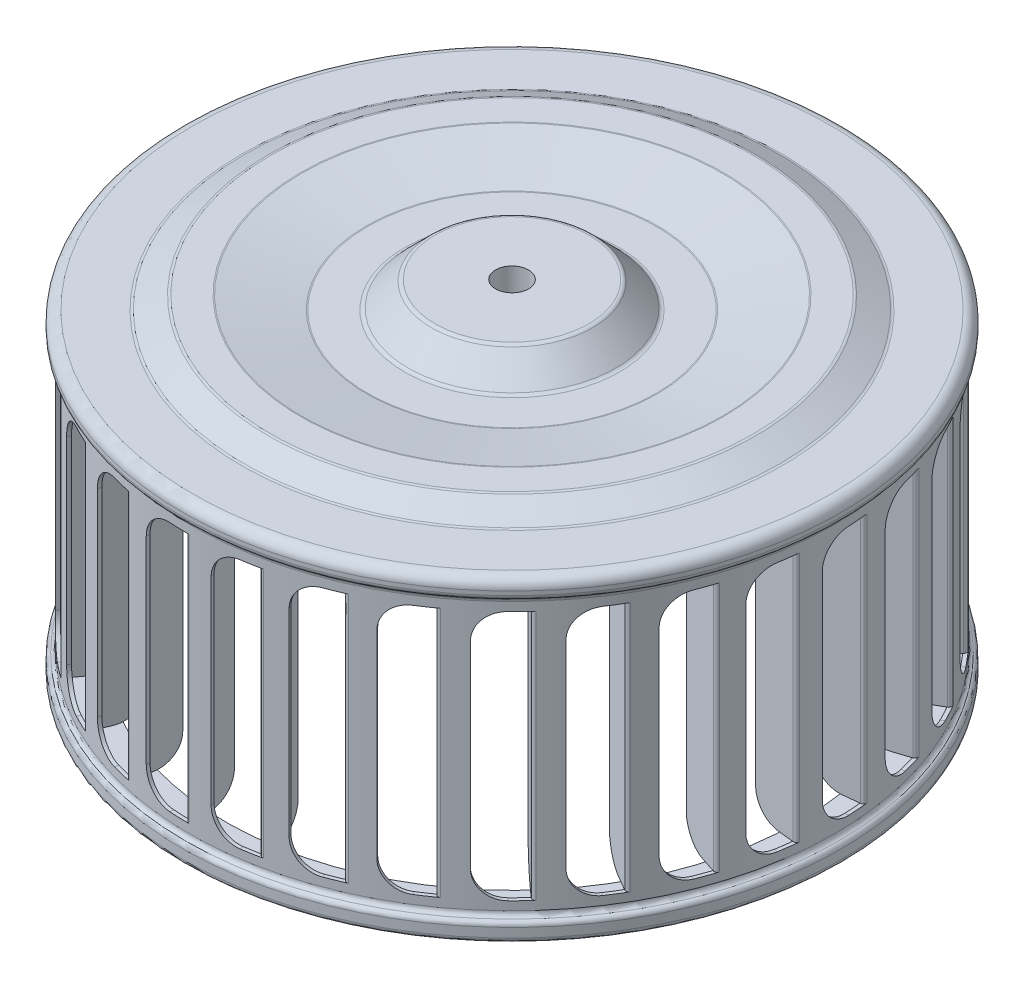
from build123d import *

# Parameters (mm, degrees)
FILLET1_R                = 1.27
CUT_EXTRUDE2_DEPTH       = 88.89999999999999
BOSS_EXTRUDE3_DEPTH      = 0.762
FILLET3_R                = 0.762
FILLET4_R                = 0.254
CIRPATTERN1_COUNT        = 30
FILLET3_OF_CIRPATTERN1_R = 0.762
FILLET4_OF_CIRPATTERN1_R = 0.254
SKETCH2_R                = 15.08125
BOSS_EXTRUDE1_DEPTH      = 19.05
FILLET2_R                = 0.508
SKETCH3_R                = 3.96875
CUT_EXTRUDE1_DEPTH       = 19.939
SKETCH8_R                = 78.74000000000001
SKETCH8_R_2              = 69.05625
BOSS_EXTRUDE4_DEPTH      = 0.762
FILLET5_R                = 2.54
FILLET6_R                = 0.762


# Read off the part's stored shape, not the designer's step: Shell1
with BuildPart() as part:
    # Sketch1 → Revolve1 (revolve)
    with BuildSketch(Plane.XY, mode=Mode.PRIVATE) as revolve1_sk:
        with BuildLine():
            Line((0, 0), (1.011e-14, -82.55))
            Line((1.011e-14, -82.55), (78.105, -82.54999999999998))
            ThreePointArc((78.105, -82.54999999999998), (79.00302561210692, -82.1780256121069), (79.37500000000001, -81.27999999999997))
            Line((79.37500000000001, -81.27999999999997), (79.37500000000001, -79.05749999999999))
            ThreePointArc((79.37500000000001, -79.05749999999999), (79.00302561210692, -78.15947438789307), (78.105, -77.78749999999998))
            Line((78.105, -77.78749999999998), (77.78750000000001, -77.78749999999998))
            Line((77.78750000000001, -77.78749999999998), (77.7875, -11.1125))
            Line((77.7875, -11.1125), (78.10499999999999, -11.1125))
            ThreePointArc((78.10499999999999, -11.1125), (79.00302561210691, -10.740525612106918), (79.375, -9.842499999999992))
            Line((79.375, -9.842499999999992), (79.375, -8.890000000000018))
            ThreePointArc((79.375, -8.890000000000018), (78.63105122421382, -7.093948775786171), (76.83499999999998, -6.35))
            Line((76.83499999999998, -6.35), (65.06980633142473, -6.349999999999999))
            ThreePointArc((65.06980633142473, -6.349999999999999), (64.77802012232958, -6.316026216624016), (64.50184506513978, -6.2159225325698895))
            Line((64.50184506513978, -6.2159225325698895), (58.688154934860215, -3.309077467430109))
            ThreePointArc((58.688154934860215, -3.309077467430109), (58.41197987767042, -3.2089737833759826), (58.12019366857527, -3.175))
            Line((58.12019366857527, -3.175), (50.92575478226284, -3.175))
            ThreePointArc((50.92575478226284, -3.175), (50.8006120074452, -3.18118067513155), (50.67668729063734, -3.1996625418725317))
            Line((50.67668729063734, -3.1996625418725317), (35.048312709362655, -6.325337458127468))
            ThreePointArc((35.048312709362655, -6.325337458127468), (34.92438799255479, -6.343819324868449), (34.79924521773715, -6.35))
            Line((34.79924521773715, -6.35), (25.926051224213833, -6.35))
            ThreePointArc((25.926051224213833, -6.35), (25.440043265110162, -6.253327006289334), (25.02802561210691, -5.9780256121069115))
            Line((25.02802561210691, -5.9780256121069115), (19.42197438789309, -0.3719743878930885))
            ThreePointArc((19.42197438789309, -0.3719743878930885), (19.009956734889837, -0.09667299371066629), (18.523948775786167, 0))
            Line((18.523948775786167, 0), (0, 0))
        make_face()
    revolve(revolve1_sk.sketch.rotate(Axis((0, 0, 0), (1.2e-16, -1, 0)), 180), axis=Axis((0, 0, 0), (1.2e-16, -1, 0)))

    # Fillet1
    fillet1_edges = [part.edges().sort_by_distance(p)[0] for p in [
        (77.78750000000002, -77.78749999999997, -1.905e-14),
        (77.7875, -11.112500000000002, -1.905e-14),
    ]]
    fillet(fillet1_edges, radius=FILLET1_R)

    # Shell1 outline → Shell1 (revolve, cut)
    with BuildSketch(Plane.XY):
        with BuildLine():
            Line((78.105, -82.55), (78.105, -81.661))
            ThreePointArc((78.105, -81.661), (78.374407684, -81.549407684), (78.486, -81.28))
            Line((78.486, -81.28), (78.486, -79.0575))
            ThreePointArc((78.486, -79.0575), (78.420908511, -78.844514525), (78.247875, -78.704303547))
            ThreePointArc((78.247875, -78.704303547), (77.267351769, -77.909774671), (76.8985, -76.70285698))
            Line((76.8985, -76.70285698), (76.8985, -12.19714302))
            ThreePointArc((76.8985, -12.19714302), (77.267351769, -10.990225329), (78.247875, -10.195696453))
            ThreePointArc((78.247875, -10.195696453), (78.420908511, -10.055485475), (78.486, -9.8425))
            Line((78.486, -9.8425), (78.486, -8.89))
            ThreePointArc((78.486, -8.89), (78.002433296, -7.722566704), (76.835, -7.239))
            Line((76.835, -7.239), (65.069806331, -7.239))
            ThreePointArc((65.069806331, -7.239), (64.573769776, -7.181244568), (64.104272179, -7.011068305))
            Line((64.104272179, -7.011068305), (58.290582048, -4.10422324))
            ThreePointArc((58.290582048, -4.10422324), (58.207729531, -4.074192135), (58.120193669, -4.064))
            Line((58.120193669, -4.064), (50.925754782, -4.064))
            ThreePointArc((50.925754782, -4.064), (50.88821195, -4.065854203), (50.851034535, -4.071398763))
            Line((50.851034535, -4.071398763), (35.222659954, -7.197073679))
            ThreePointArc((35.222659954, -7.197073679), (35.011987935, -7.228492852), (34.799245218, -7.239))
            Line((34.799245218, -7.239), (25.926051224, -7.239))
            ThreePointArc((25.926051224, -7.239), (25.099837694, -7.074655911), (24.399407684, -6.606643541))
            Line((24.399407684, -6.606643541), (18.793356459, -1.000592316))
            ThreePointArc((18.793356459, -1.000592316), (18.669751163, -0.918001898), (18.523948776, -0.889))
            Line((18.523948776, -0.889), (0, -0.889))
            Line((0, -0.889), (0, -82.55))
            Line((0, -82.55), (78.105, -82.55))
        make_face()
    revolve(axis=Axis((0, 0, 0), (0, 1, 0)), mode=Mode.SUBTRACT)

    # Sketch4 → Cut-Extrude2 (cut)
    with BuildSketch(Plane.XY):
        with BuildLine():
            Line((5.44e-15, -14.287500000000009), (9.14e-15, -74.61250000000001))
            Line((9.14e-15, -74.61250000000001), (-4.762499999999946, -74.61250000000001))
            ThreePointArc((-4.762499999999946, -74.61250000000001), (-9.252628060534573, -72.75262806053459), (-11.11249999999999, -68.26249999999996))
            Line((-11.11249999999999, -68.26249999999996), (-11.112499999999997, -20.637500000000053))
            ThreePointArc((-11.112499999999997, -20.637500000000053), (-9.252628060534576, -16.147371939465433), (-4.762499999999952, -14.287500000000009))
            Line((-4.762499999999952, -14.287500000000009), (5.44e-15, -14.287500000000009))
        make_face()
    cut_extrude2 = extrude(amount=CUT_EXTRUDE2_DEPTH, mode=Mode.SUBTRACT)

    # Sketch7 → Boss-Extrude3 (add)
    with BuildSketch(Plane.ZY):
        with BuildLine():
            Line((77.7875, -14.287500000000009), (72.96150000000004, -14.287500000000009))
            ThreePointArc((72.96150000000004, -14.287500000000009), (68.6509770618868, -16.072977061886814), (66.8655, -20.383500000000055))
            Line((66.8655, -20.383500000000055), (66.86550000000001, -68.51649999999997))
            ThreePointArc((66.86550000000001, -68.51649999999997), (68.65097706188682, -72.8270229381132), (72.96150000000006, -74.61250000000001))
            Line((72.96150000000006, -74.61250000000001), (77.7875, -74.61250000000001))
            Line((77.7875, -74.61250000000001), (77.7875, -14.287500000000009))
        make_face()
    boss_extrude3 = extrude(amount=BOSS_EXTRUDE3_DEPTH)

    # Fillet3
    # the kernel refuses this fillet: 0.762 mm, written as the material it takes off along each edge
    with BuildSketch(Plane(origin=(-0.7619999999999955, -74.61250000000001, 77.7875), x_dir=(1, 6e-17, 0), z_dir=(-6e-17, 1, 0))) as fillet3_piece_1:
        with BuildLine():
            CenterArc((FILLET3_R, FILLET3_R), FILLET3_R, 180, 90)
            Line((-1.1e-16, FILLET3_R), (0, 0))
            Line((0, 0), (FILLET3_R, 0))
        make_face()
    extrude(amount=60.325, mode=Mode.SUBTRACT)

    # Fillet4
    fillet4_edges = [part.edges().sort_by_distance(p)[0] for p in [
        (9.27e-15, -44.45000000000001, 76.8985),
    ]]
    fillet(fillet4_edges, radius=FILLET4_R)

    # CirPattern1: Cut-Extrude2, Boss-Extrude3 ×30 about axis
    cirpattern1_axis = Axis((1.048e-14, 0, -8e-16), (0, 1, 0))
    add([cut_extrude2.rotate(cirpattern1_axis, i * 360 / CIRPATTERN1_COUNT) for i in range(1, CIRPATTERN1_COUNT)], mode=Mode.SUBTRACT)
    add([boss_extrude3.rotate(cirpattern1_axis, i * 360 / CIRPATTERN1_COUNT) for i in range(1, CIRPATTERN1_COUNT)])

    # Fillet3 of CirPattern1
    # the kernel refuses this fillet: 0.762 mm, written as the material it takes off along each edge
    with BuildSketch(Plane(origin=(15.427582177727297, -74.61250000000001, 76.24608520048405), x_dir=(-0.20791169081775512, 0, -0.9781476007338065), z_dir=(-6e-17, 1, 1e-17)), Plane(origin=(-15.42758217772729, -74.61250000000001, -76.24608520048405), x_dir=(0.20791169081775512, 0, 0.9781476007338065), z_dir=(6e-17, 1, -1e-17))) as fillet3_of_cirpattern1_piece_1:
        with BuildLine():
            CenterArc((FILLET3_OF_CIRPATTERN1_R, -FILLET3_OF_CIRPATTERN1_R), FILLET3_OF_CIRPATTERN1_R, 90.00000000000051, 89.99999999999949)
            Line((6.59e-15, -FILLET3_OF_CIRPATTERN1_R), (0, 0))
            Line((0, 0), (FILLET3_OF_CIRPATTERN1_R, 0))
        make_face()
    extrude(amount=60.325, mode=Mode.SUBTRACT)
    with BuildSketch(Plane(origin=(30.94290498453515, -74.61250000000001, 71.37235060839758), x_dir=(-0.40673664307579044, 0, -0.9135454576426052), z_dir=(-6e-17, 1, 2e-17))) as fillet3_of_cirpattern1_piece_2:
        with BuildLine():
            CenterArc((FILLET3_OF_CIRPATTERN1_R, -FILLET3_OF_CIRPATTERN1_R), FILLET3_OF_CIRPATTERN1_R, 90.00000000000115, 89.99999999999879)
            Line((3.104e-14, -FILLET3_OF_CIRPATTERN1_R), (0, 0))
            Line((0, 0), (FILLET3_OF_CIRPATTERN1_R, -3e-17))
        make_face()
    extrude(amount=60.325, mode=Mode.SUBTRACT)
    with BuildSketch(Plane(origin=(45.10587436298705, -74.61250000000001, 63.37930181218809), x_dir=(-0.5877852522924838, 0, -0.8090169943749398), z_dir=(-5e-17, 1, 4e-17))) as fillet3_of_cirpattern1_piece_3:
        with BuildLine():
            CenterArc((FILLET3_OF_CIRPATTERN1_R, -FILLET3_OF_CIRPATTERN1_R), FILLET3_OF_CIRPATTERN1_R, 89.99999999999913, 90.0000000000012)
            Line((-5.8e-15, -FILLET3_OF_CIRPATTERN1_R), (0, 0))
            Line((0, 0), (FILLET3_OF_CIRPATTERN1_R, -4e-17))
        make_face()
    extrude(amount=60.325, mode=Mode.SUBTRACT)
    with BuildSketch(Plane(origin=(57.29750058977736, -74.61250000000001, 52.616273399153464), x_dir=(-0.7431448254773954, 0, -0.669130606358857), z_dir=(-4e-17, 1, 5e-17))) as fillet3_of_cirpattern1_piece_4:
        with BuildLine():
            CenterArc((FILLET3_OF_CIRPATTERN1_R, -FILLET3_OF_CIRPATTERN1_R), FILLET3_OF_CIRPATTERN1_R, 90.00000000000004, 90)
            Line((1.054e-14, -FILLET3_OF_CIRPATTERN1_R), (0, 0))
            Line((0, 0), (FILLET3_OF_CIRPATTERN1_R, 1e-17))
        make_face()
    extrude(amount=60.325, mode=Mode.SUBTRACT)
    with BuildSketch(Plane(origin=(66.98495109688201, -74.61250000000001, 39.55366135768375), x_dir=(-0.8660254037844424, 0, -0.49999999999999367), z_dir=(-3e-17, 1, 5e-17))) as fillet3_of_cirpattern1_piece_5:
        with BuildLine():
            CenterArc((FILLET3_OF_CIRPATTERN1_R, -FILLET3_OF_CIRPATTERN1_R), FILLET3_OF_CIRPATTERN1_R, 89.99999999999946, 90.00000000000045)
            Line((8.76e-15, -FILLET3_OF_CIRPATTERN1_R), (0, 0))
            Line((0, 0), (FILLET3_OF_CIRPATTERN1_R, 3e-17))
        make_face()
    extrude(amount=60.325, mode=Mode.SUBTRACT)
    with BuildSketch(Plane(origin=(73.74483781159554, -74.61250000000001, 24.762364515358136), x_dir=(-0.951056516295152, 0, -0.3090169943749525), z_dir=(-2e-17, 1, 6e-17)), Plane(origin=(-73.74483781159552, -74.61250000000001, -24.762364515358136), x_dir=(0.951056516295152, 0, 0.3090169943749525), z_dir=(2e-17, 1, -6e-17))) as fillet3_of_cirpattern1_piece_6:
        with BuildLine():
            CenterArc((FILLET3_OF_CIRPATTERN1_R, -FILLET3_OF_CIRPATTERN1_R), FILLET3_OF_CIRPATTERN1_R, 89.99999999999993, 89.99999999999982)
            Line((-2.31e-15, -FILLET3_OF_CIRPATTERN1_R), (0, 0))
            Line((0, 0), (FILLET3_OF_CIRPATTERN1_R, -2e-17))
        make_face()
    extrude(amount=60.325, mode=Mode.SUBTRACT)
    with BuildSketch(Plane(origin=(77.28172124694962, -74.61250000000001, 8.888833520703217), x_dir=(-0.9945218953682738, 0, -0.10452846326764904), z_dir=(-1e-17, 1, 6e-17))) as fillet3_of_cirpattern1_piece_7:
        with BuildLine():
            CenterArc((FILLET3_OF_CIRPATTERN1_R, -FILLET3_OF_CIRPATTERN1_R), FILLET3_OF_CIRPATTERN1_R, 89.99999999999973, 90.00000000000028)
            Line((1.07e-14, -FILLET3_OF_CIRPATTERN1_R), (0, 0))
            Line((0, 0), (FILLET3_OF_CIRPATTERN1_R, 0))
        make_face()
    extrude(amount=60.325, mode=Mode.SUBTRACT)
    with BuildSketch(Plane(origin=(77.44102262496952, -74.61250000000001, -7.37318215216197), x_dir=(-0.9945218953682734, 0, 0.10452846326765329), z_dir=(1e-17, 1, 6e-17))) as fillet3_of_cirpattern1_piece_8:
        with BuildLine():
            CenterArc((FILLET3_OF_CIRPATTERN1_R, -FILLET3_OF_CIRPATTERN1_R), FILLET3_OF_CIRPATTERN1_R, 90.00000000000003, 89.99999999999997)
            Line((3.7e-16, -FILLET3_OF_CIRPATTERN1_R), (0, 0))
            Line((0, 0), (FILLET3_OF_CIRPATTERN1_R, 0))
        make_face()
    extrude(amount=60.325, mode=Mode.SUBTRACT)
    with BuildSketch(Plane(origin=(74.21577971102299, -74.61250000000001, -23.31295438452431), x_dir=(-0.9510565162951551, 0, 0.3090169943749428), z_dir=(2e-17, 1, 6e-17))) as fillet3_of_cirpattern1_piece_9:
        with BuildLine():
            CenterArc((FILLET3_OF_CIRPATTERN1_R, -FILLET3_OF_CIRPATTERN1_R), FILLET3_OF_CIRPATTERN1_R, 90.00000000000067, 89.99999999999933)
            Line((8.97e-15, -FILLET3_OF_CIRPATTERN1_R), (0, 0))
            Line((0, 0), (FILLET3_OF_CIRPATTERN1_R, 1e-17))
        make_face()
    extrude(amount=60.325, mode=Mode.SUBTRACT)
    with BuildSketch(Plane(origin=(67.74695109688203, -74.61250000000001, -38.23383864231624), x_dir=(-0.8660254037844336, 0, 0.5000000000000087), z_dir=(3e-17, 1, 5e-17))) as fillet3_of_cirpattern1_piece_10:
        with BuildLine():
            CenterArc((FILLET3_OF_CIRPATTERN1_R, -FILLET3_OF_CIRPATTERN1_R), FILLET3_OF_CIRPATTERN1_R, 89.99999999999955, 90.00000000000045)
            Line((-6.16e-15, -FILLET3_OF_CIRPATTERN1_R), (0, 0))
            Line((0, 0), (FILLET3_OF_CIRPATTERN1_R, 1e-17))
        make_face()
    extrude(amount=60.325, mode=Mode.SUBTRACT)
    with BuildSketch(Plane(origin=(58.31725563386827, -74.61250000000001, -51.483720685125895), x_dir=(-0.7431448254773995, 0, 0.6691306063588524), z_dir=(4e-17, 1, 5e-17))) as fillet3_of_cirpattern1_piece_11:
        with BuildLine():
            CenterArc((FILLET3_OF_CIRPATTERN1_R, -FILLET3_OF_CIRPATTERN1_R), FILLET3_OF_CIRPATTERN1_R, 90.00000000000031, 89.9999999999996)
            Line((2.429e-14, -FILLET3_OF_CIRPATTERN1_R), (0, 0))
            Line((0, 0), (FILLET3_OF_CIRPATTERN1_R, -2e-17))
        make_face()
    extrude(amount=60.325, mode=Mode.SUBTRACT)
    with BuildSketch(Plane(origin=(46.33881626241448, -74.61250000000001, -62.48351708769435), x_dir=(-0.5877852522924698, 0, 0.8090169943749498), z_dir=(5e-17, 1, 4e-17))) as fillet3_of_cirpattern1_piece_12:
        with BuildLine():
            CenterArc((FILLET3_OF_CIRPATTERN1_R, -FILLET3_OF_CIRPATTERN1_R), FILLET3_OF_CIRPATTERN1_R, 89.99999999999989, 90.00000000000034)
            Line((-1.725e-14, -FILLET3_OF_CIRPATTERN1_R), (0, 0))
            Line((0, 0), (FILLET3_OF_CIRPATTERN1_R, 1e-17))
        make_face()
    extrude(amount=60.325, mode=Mode.SUBTRACT)
    with BuildSketch(Plane(origin=(32.3351482619825, -74.61250000000001, -70.75248396435003), x_dir=(-0.40673664307580515, 0, 0.9135454576425986), z_dir=(6e-17, 1, 2e-17))) as fillet3_of_cirpattern1_piece_13:
        with BuildLine():
            CenterArc((FILLET3_OF_CIRPATTERN1_R, -FILLET3_OF_CIRPATTERN1_R), FILLET3_OF_CIRPATTERN1_R, 89.99999999999979, 90.00000000000004)
            Line((1.155e-14, -FILLET3_OF_CIRPATTERN1_R), (0, 0))
            Line((0, 0), (FILLET3_OF_CIRPATTERN1_R, -1e-17))
        make_face()
    extrude(amount=60.325, mode=Mode.SUBTRACT)
    with BuildSketch(Plane(origin=(16.91827912124563, -74.61250000000001, -75.92922778367777), x_dir=(-0.20791169081776026, 0, 0.9781476007338054), z_dir=(6e-17, 1, 1e-17))) as fillet3_of_cirpattern1_piece_14:
        with BuildLine():
            CenterArc((FILLET3_OF_CIRPATTERN1_R, -FILLET3_OF_CIRPATTERN1_R), FILLET3_OF_CIRPATTERN1_R, 89.99999999999979, 90.00000000000051)
            Line((1.242e-14, -FILLET3_OF_CIRPATTERN1_R), (0, 0))
            Line((0, 0), (FILLET3_OF_CIRPATTERN1_R, 1e-17))
        make_face()
    extrude(amount=60.325, mode=Mode.SUBTRACT)
    with BuildSketch(Plane(origin=(0.762000000000026, -74.61250000000001, -77.7875), x_dir=(-1.5e-16, 0, 1), z_dir=(6e-17, 1, 0))) as fillet3_of_cirpattern1_piece_15:
        with BuildLine():
            CenterArc((FILLET3_OF_CIRPATTERN1_R, -FILLET3_OF_CIRPATTERN1_R), FILLET3_OF_CIRPATTERN1_R, 90.00000000000001, 89.99999999999999)
            Line((1.1e-16, -FILLET3_OF_CIRPATTERN1_R), (0, 0))
            Line((0, 0), (FILLET3_OF_CIRPATTERN1_R, 0))
        make_face()
    extrude(amount=60.325, mode=Mode.SUBTRACT)
    with BuildSketch(Plane(origin=(-30.94290498453513, -74.61250000000001, -71.37235060839757), x_dir=(0.4067366430757974, 0, 0.9135454576426021), z_dir=(6e-17, 1, -2e-17))) as fillet3_of_cirpattern1_piece_16:
        with BuildLine():
            CenterArc((FILLET3_OF_CIRPATTERN1_R, -FILLET3_OF_CIRPATTERN1_R), FILLET3_OF_CIRPATTERN1_R, 90.00000000000071, 89.99999999999903)
            Line((1.082e-14, -FILLET3_OF_CIRPATTERN1_R), (0, 0))
            Line((0, 0), (FILLET3_OF_CIRPATTERN1_R, -2e-17))
        make_face()
    extrude(amount=60.325, mode=Mode.SUBTRACT)
    with BuildSketch(Plane(origin=(-45.10587436298702, -74.61250000000001, -63.379301812188096), x_dir=(0.5877852522924748, 0, 0.8090169943749462), z_dir=(5e-17, 1, -4e-17))) as fillet3_of_cirpattern1_piece_17:
        with BuildLine():
            CenterArc((FILLET3_OF_CIRPATTERN1_R, -FILLET3_OF_CIRPATTERN1_R), FILLET3_OF_CIRPATTERN1_R, 89.99999999999976, 89.9999999999997)
            Line((1.102e-14, -FILLET3_OF_CIRPATTERN1_R), (0, 0))
            Line((0, 0), (FILLET3_OF_CIRPATTERN1_R, 3e-17))
        make_face()
    extrude(amount=60.325, mode=Mode.SUBTRACT)
    with BuildSketch(Plane(origin=(-57.29750058977734, -74.61250000000001, -52.616273399153464), x_dir=(0.7431448254773911, 0, 0.6691306063588616), z_dir=(4e-17, 1, -5e-17))) as fillet3_of_cirpattern1_piece_18:
        with BuildLine():
            CenterArc((FILLET3_OF_CIRPATTERN1_R, -FILLET3_OF_CIRPATTERN1_R), FILLET3_OF_CIRPATTERN1_R, 90.00000000000041, 89.9999999999996)
            Line((1.528e-14, -FILLET3_OF_CIRPATTERN1_R), (0, 0))
            Line((0, 0), (FILLET3_OF_CIRPATTERN1_R, -1e-17))
        make_face()
    extrude(amount=60.325, mode=Mode.SUBTRACT)
    with BuildSketch(Plane(origin=(-66.98495109688199, -74.61250000000001, -39.55366135768378), x_dir=(0.8660254037844418, 0, 0.4999999999999948), z_dir=(3e-17, 1, -5e-17))) as fillet3_of_cirpattern1_piece_19:
        with BuildLine():
            CenterArc((FILLET3_OF_CIRPATTERN1_R, -FILLET3_OF_CIRPATTERN1_R), FILLET3_OF_CIRPATTERN1_R, 89.99999999999955, 90.00000000000045)
            Line((-6.16e-15, -FILLET3_OF_CIRPATTERN1_R), (0, 0))
            Line((0, 0), (FILLET3_OF_CIRPATTERN1_R, 1e-17))
        make_face()
    extrude(amount=60.325, mode=Mode.SUBTRACT)
    with BuildSketch(Plane(origin=(-77.2817212469496, -74.61250000000001, -8.88883352070321), x_dir=(0.9945218953682736, 0, 0.10452846326765097), z_dir=(1e-17, 1, -6e-17))) as fillet3_of_cirpattern1_piece_20:
        with BuildLine():
            CenterArc((FILLET3_OF_CIRPATTERN1_R, -FILLET3_OF_CIRPATTERN1_R), FILLET3_OF_CIRPATTERN1_R, 89.99999999999983, 90.00000000000017)
            Line((-2.14e-15, -FILLET3_OF_CIRPATTERN1_R), (0, 0))
            Line((0, 0), (FILLET3_OF_CIRPATTERN1_R, 0))
        make_face()
    extrude(amount=60.325, mode=Mode.SUBTRACT)
    with BuildSketch(Plane(origin=(-77.4410226249695, -74.61250000000001, 7.373182152161926), x_dir=(0.9945218953682732, 0, -0.1045284632676556), z_dir=(-1e-17, 1, -6e-17))) as fillet3_of_cirpattern1_piece_21:
        with BuildLine():
            CenterArc((FILLET3_OF_CIRPATTERN1_R, -FILLET3_OF_CIRPATTERN1_R), FILLET3_OF_CIRPATTERN1_R, 89.9999999999999, 90.0000000000001)
            Line((-1.39e-15, -FILLET3_OF_CIRPATTERN1_R), (0, 0))
            Line((0, 0), (FILLET3_OF_CIRPATTERN1_R, 0))
        make_face()
    extrude(amount=60.325, mode=Mode.SUBTRACT)
    with BuildSketch(Plane(origin=(-74.21577971102296, -74.61250000000001, 23.312954384524293), x_dir=(0.9510565162951551, 0, -0.3090169943749428), z_dir=(-2e-17, 1, -6e-17))) as fillet3_of_cirpattern1_piece_22:
        with BuildLine():
            CenterArc((FILLET3_OF_CIRPATTERN1_R, -FILLET3_OF_CIRPATTERN1_R), FILLET3_OF_CIRPATTERN1_R, 90.00000000000067, 89.99999999999908)
            Line((1.007e-14, -FILLET3_OF_CIRPATTERN1_R), (0, 0))
            Line((0, 0), (FILLET3_OF_CIRPATTERN1_R, 1e-17))
        make_face()
    extrude(amount=60.325, mode=Mode.SUBTRACT)
    with BuildSketch(Plane(origin=(-67.74695109688201, -74.61250000000001, 38.23383864231626), x_dir=(0.8660254037844376, 0, -0.5000000000000017), z_dir=(-3e-17, 1, -5e-17))) as fillet3_of_cirpattern1_piece_23:
        with BuildLine():
            CenterArc((FILLET3_OF_CIRPATTERN1_R, -FILLET3_OF_CIRPATTERN1_R), FILLET3_OF_CIRPATTERN1_R, 90, 90)
            Line((1e-17, -FILLET3_OF_CIRPATTERN1_R), (0, 0))
            Line((0, 0), (FILLET3_OF_CIRPATTERN1_R, -1e-17))
        make_face()
    extrude(amount=60.325, mode=Mode.SUBTRACT)
    with BuildSketch(Plane(origin=(-58.31725563386828, -74.61250000000001, 51.48372068512586), x_dir=(0.7431448254774, 0, -0.6691306063588519), z_dir=(-4e-17, 1, -5e-17))) as fillet3_of_cirpattern1_piece_24:
        with BuildLine():
            CenterArc((FILLET3_OF_CIRPATTERN1_R, -FILLET3_OF_CIRPATTERN1_R), FILLET3_OF_CIRPATTERN1_R, 90.00000000000036, 89.99999999999959)
            Line((1.479e-14, -FILLET3_OF_CIRPATTERN1_R), (0, 0))
            Line((0, 0), (FILLET3_OF_CIRPATTERN1_R, -2e-17))
        make_face()
    extrude(amount=60.325, mode=Mode.SUBTRACT)
    with BuildSketch(Plane(origin=(-46.33881626241447, -74.61250000000001, 62.483517087694345), x_dir=(0.5877852522924698, 0, -0.8090169943749498), z_dir=(-5e-17, 1, -4e-17))) as fillet3_of_cirpattern1_piece_25:
        with BuildLine():
            CenterArc((FILLET3_OF_CIRPATTERN1_R, -FILLET3_OF_CIRPATTERN1_R), FILLET3_OF_CIRPATTERN1_R, 89.99999999999989, 90)
            Line((-1.15e-14, -FILLET3_OF_CIRPATTERN1_R), (0, 0))
            Line((0, 0), (FILLET3_OF_CIRPATTERN1_R, 1e-17))
        make_face()
    extrude(amount=60.325, mode=Mode.SUBTRACT)
    with BuildSketch(Plane(origin=(-32.33514826198246, -74.61250000000001, 70.75248396435005), x_dir=(0.40673664307580515, 0, -0.9135454576425986), z_dir=(-6e-17, 1, -2e-17))) as fillet3_of_cirpattern1_piece_26:
        with BuildLine():
            CenterArc((FILLET3_OF_CIRPATTERN1_R, -FILLET3_OF_CIRPATTERN1_R), FILLET3_OF_CIRPATTERN1_R, 89.99999999999979, 89.99999999999979)
            Line((1.011e-14, -FILLET3_OF_CIRPATTERN1_R), (0, 0))
            Line((0, 0), (FILLET3_OF_CIRPATTERN1_R, -1e-17))
        make_face()
    extrude(amount=60.325, mode=Mode.SUBTRACT)
    with BuildSketch(Plane(origin=(-16.918279121245654, -74.61250000000001, 75.92922778367776), x_dir=(0.20791169081776473, 0, -0.9781476007338045), z_dir=(-6e-17, 1, -1e-17))) as fillet3_of_cirpattern1_piece_27:
        with BuildLine():
            CenterArc((FILLET3_OF_CIRPATTERN1_R, -FILLET3_OF_CIRPATTERN1_R), FILLET3_OF_CIRPATTERN1_R, 90.00000000000006, 90.00000000000023)
            Line((1.589e-14, -FILLET3_OF_CIRPATTERN1_R), (0, 0))
            Line((0, 0), (FILLET3_OF_CIRPATTERN1_R, 1e-17))
        make_face()
    extrude(amount=60.325, mode=Mode.SUBTRACT)

    # Fillet4 of CirPattern1
    fillet4_of_cirpattern1_edges = [part.edges().sort_by_distance(p)[0] for p in [
        (15.988097156349475, -44.45000000000001, 75.21808327502856),
        (31.277437747564427, -44.45000000000001, 70.25027537452954),
        (45.199804223412755, -44.45000000000001, 62.2121933419419),
        (57.14672236197342, -44.45000000000001, 51.455139933086656),
        (66.59605451291765, -44.45000000000001, 38.449250000000006),
        (73.13481951832287, -44.45000000000001, 23.7629433419419),
        (76.47724197097718, -44.45000000000001, 8.03808203258765),
        (76.47724197097718, -44.45000000000001, -8.038082032587656),
        (73.13481951832289, -44.45000000000001, -23.762943341941885),
        (66.59605451291768, -44.45000000000001, -38.449249999999985),
        (57.14672236197342, -44.45000000000001, -51.455139933086656),
        (45.19980422341277, -44.45000000000001, -62.212193341941884),
        (31.277437747564452, -44.45000000000001, -70.25027537452954),
        (15.988097156349477, -44.45000000000001, -75.21808327502856),
        (2.111e-14, -44.45000000000001, -76.8985),
        (-15.988097156349466, -44.45000000000001, -75.21808327502855),
        (-31.277437747564406, -44.45, -70.25027537452954),
        (-45.19980422341272, -44.45, -62.212193341941905),
        (-57.1467223619734, -44.45000000000001, -51.45513993308665),
        (-66.59605451291762, -44.45000000000001, -38.449250000000035),
        (-73.13481951832284, -44.45, -23.76294334194191),
        (-76.47724197097716, -44.45000000000001, -8.038082032587644),
        (-76.47724197097716, -44.45000000000001, 8.038082032587612),
        (-73.13481951832287, -44.45000000000001, 23.762943341941874),
        (-66.59605451291765, -44.45000000000001, 38.449250000000006),
        (-57.14672236197342, -44.45000000000001, 51.45513993308663),
        (-45.199804223412755, -44.45000000000001, 62.212193341941884),
        (-31.27743774756441, -44.45000000000001, 70.25027537452955),
        (-15.988097156349498, -44.45000000000001, 75.21808327502855),
    ]]
    fillet(fillet4_of_cirpattern1_edges, radius=FILLET4_OF_CIRPATTERN1_R)

    # Sketch2 → Boss-Extrude1 (add)
    with BuildSketch(Plane.XZ.offset(0.8890000000000009)):
        with Locations(Location((-1.6e-16, 0, 0), (0, 0, 180))):
            Circle(SKETCH2_R)
    extrude(amount=BOSS_EXTRUDE1_DEPTH)

    # Fillet2
    fillet2_edges = [part.edges().sort_by_distance(p)[0] for p in [
        (15.081250000000002, -19.938999999999997, -3.69e-15),
    ]]
    fillet(fillet2_edges, radius=FILLET2_R)

    # Sketch3 → Cut-Extrude1 (cut)
    with BuildSketch(Plane.XZ.offset(19.939000000000004)):
        Circle(SKETCH3_R)
    extrude(amount=-CUT_EXTRUDE1_DEPTH, mode=Mode.SUBTRACT)

    # Sketch8 → Boss-Extrude4 (add)
    with BuildSketch(Plane(origin=(9.72e-15, -79.375, 0), x_dir=(1, 1.2e-16, 0), z_dir=(-1.2e-16, 1, 0))):
        Circle(SKETCH8_R)
        Circle(SKETCH8_R_2, mode=Mode.SUBTRACT)
    extrude(amount=BOSS_EXTRUDE4_DEPTH)

    # Sketch9 → Revolve2 (revolve)
    with BuildSketch(Plane.XY):
        with BuildLine():
            Line((-78.88452961799074, -79.12100000000001), (-78.88452961799074, -81.66100000000002))
            Line((-78.88452961799074, -81.66100000000002), (-76.7038064934448, -81.66100000000002))
            ThreePointArc((-76.7038064934448, -81.66100000000002), (-74.89292467547396, -80.91954601752074), (-74.12202961799073, -79.12100000000001))
            Line((-74.12202961799073, -79.12100000000001), (-78.88452961799074, -79.12100000000001))
        make_face()
    revolve(axis=Axis((0, 0, 0), (1.7e-16, -1, 0)))

    # Fillet5
    # the kernel refuses this fillet: 2.54 mm, written as the material it adds along each edge
    with BuildSketch(Plane(origin=(1.333e-14, -79.375, 0), x_dir=(-1, -1.9e-16, 0), z_dir=(0, 0, 1))) as fillet5_piece_1:
        with BuildLine():
            CenterArc((72.43853526512106, 2.5400000000000067), FILLET5_R, 270, 56.378747785262526)
            Line((74.5536336988822, 1.1336008335109256), (74.59593566755741, 1.105472850181144))
            ThreePointArc((74.59593566755741, 1.105472850181144), (74.32670724898843, 0.5739268872147107), (74.18918680218131, -0.0058258004212064))
            Line((74.18918680218131, -0.0058258004212064), (74.13872196244658, -0.05079999999999529))
            Line((74.13872196244658, -0.05079999999999529), (72.43853526512106, -0.05079999999999497))
            Line((72.43853526512106, -0.05079999999999497), (72.43853526512106, 3.3e-16))
        make_face()
    revolve(axis=Axis((1.333e-14, -79.375, 0), (1.7e-16, -1, 0)))
    with BuildSketch(Plane(origin=(0, -81.661, 0), x_dir=(1, 0, 0), z_dir=(0, 0, 1))) as fillet5_piece_2:
        with BuildLine():
            CenterArc((76.14943185388829, -2.5099112332003415), FILLET5_R, 39.65430739824966, 44.132314850710884)
            Line((78.1049999999997, -0.8890000000002232), (78.30055681461084, -0.7269088766802128))
            ThreePointArc((78.30055681461084, -0.7269088766802128), (78.35900000000001, -0.4445000000001187), (78.35900000000001, 0))
            Line((78.35900000000001, 0), (78.105, 0.2540000000000049))
            ThreePointArc((78.105, 0.2540000000000049), (76.70380649344483, 0.2540000000000191), (76.45183058915795, 0.26767603003861495))
            Line((76.45183058915795, 0.26767603003861495), (76.42433979504253, 0.01516809701689681))
        make_face()
    revolve(axis=Axis((0, -81.661, 0), (0, 1, 0)))

    # Fillet6
    fillet6_edges = [part.edges().sort_by_distance(p)[0] for p in [
        (-4.24e-15, -82.54999999999998, -78.105),
    ]]
    fillet(fillet6_edges, radius=FILLET6_R)

    # Sketch10 → Cut-Revolve1 (revolve, cut)
    with BuildSketch(Plane.XY, mode=Mode.PRIVATE) as cut_revolve1_sk:
        Polygon((6.35, -2.5399999999999996), (12.445999999999998, -2.5399999999999996), (12.446, -13.207999999999998), (6.350000000000001, -13.207999999999998), align=None)
    revolve(cut_revolve1_sk.sketch.rotate(Axis((0, 0, 0), (1.3e-16, -1, 0)), 180), axis=Axis((0, 0, 0), (1.3e-16, -1, 0)), mode=Mode.SUBTRACT)


solid = part.part
